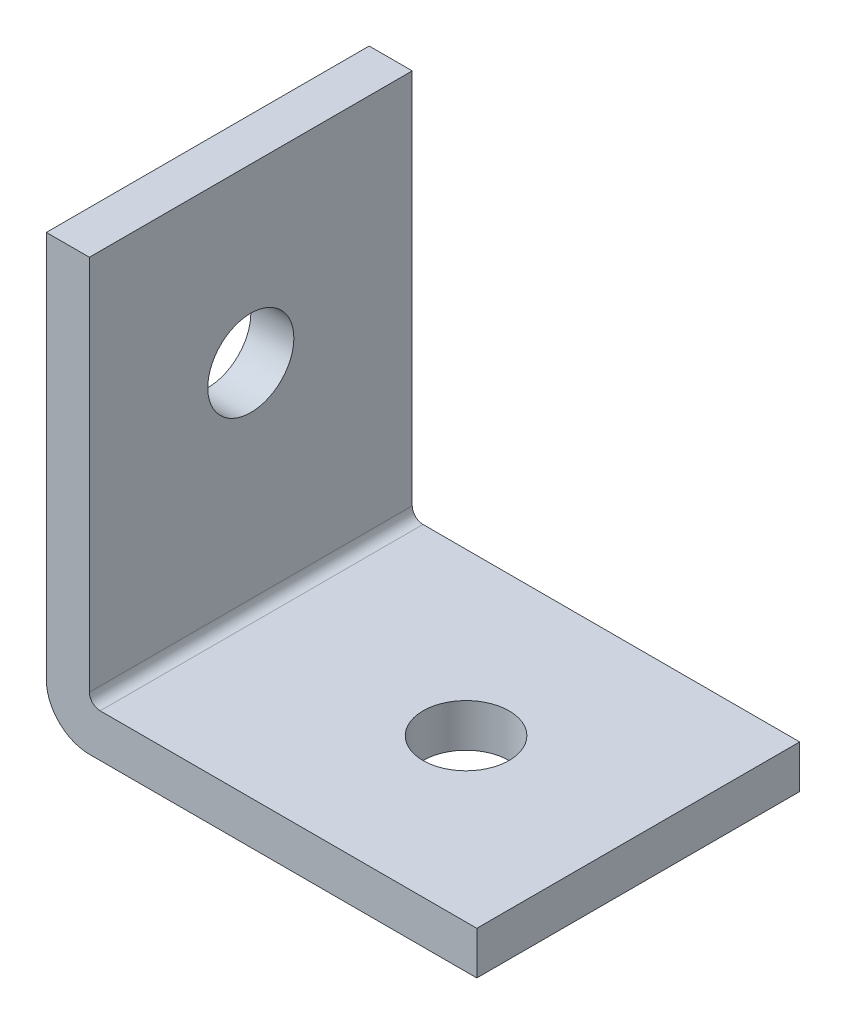
from build123d import *

# Parameters (mm, degrees)
BOSS_EXTRUDE1_DEPTH = 15
SKETCH3_R           = 2
CUT_EXTRUDE2_DEPTH  = 31.805843601
SKETCH4_R           = 2
CUT_EXTRUDE3_DEPTH  = 31.805843601


with BuildPart() as part:
    # Sketch1 → Boss-Extrude1 (new body)
    with BuildSketch(Plane.XY):
        with BuildLine():
            Line((0, 2), (0, 20))
            Line((0, 20), (2, 20))
            Line((2, 20), (2, 2.5))
            ThreePointArc((2, 2.5), (2.146446609, 2.146446609), (2.5, 2))
            Line((2.5, 2), (20, 2))
            Line((20, 2), (20, 0))
            Line((20, 0), (2, 0))
            ThreePointArc((2, 0), (0.585786438, 0.585786438), (0, 2))
        make_face()
    extrude(amount=BOSS_EXTRUDE1_DEPTH)

    # Sketch3 → Cut-Extrude2 (cut, through all)
    with BuildSketch(Plane(origin=(0, 2, 0), x_dir=(1, 0, 0), z_dir=(0, 1, 0))):
        with Locations((12, -7.5)):
            Circle(SKETCH3_R)
    extrude(amount=-CUT_EXTRUDE2_DEPTH, mode=Mode.SUBTRACT)

    # Sketch4 → Cut-Extrude3 (cut, through all)
    with BuildSketch(Plane(origin=(2, 0, 0), x_dir=(0, 0, -1), z_dir=(1, 0, 0))):
        with Locations((-7.5, 12)):
            Circle(SKETCH4_R)
    extrude(amount=-CUT_EXTRUDE3_DEPTH, mode=Mode.SUBTRACT)


solid = part.part
